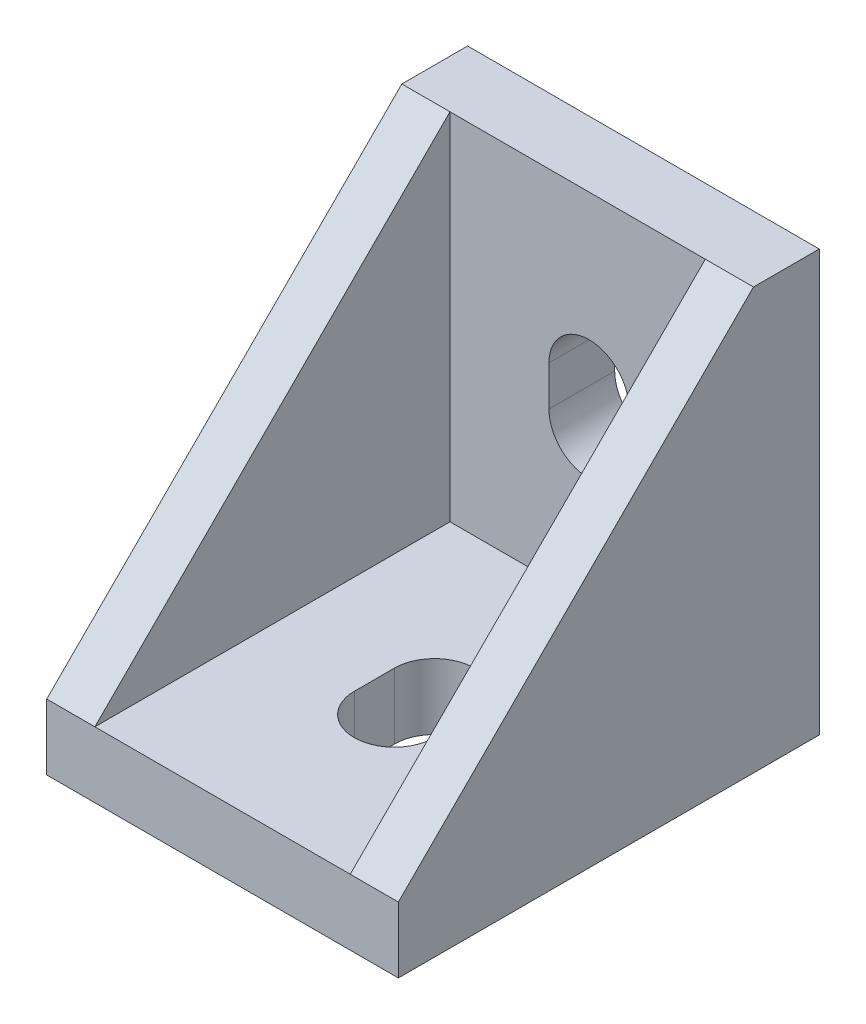
from build123d import *

# Parameters (mm, degrees)
SKETCH1_W           = 16.7005
SKETCH1_H           = 19.9898
BOSS_EXTRUDE1_DEPTH = 3.1242
SKETCH3_W           = 16.7005
SKETCH3_H           = 3.1242
BOSS_EXTRUDE2_DEPTH = 19.9898
BOSS_EXTRUDE3_DEPTH = 2.286
BOSS_EXTRUDE4_DEPTH = 2.286
CUT_EXTRUDE1_REACH  = 29.455
SKETCH6_R           = 1.905
CUT_EXTRUDE2_START  = -3.1242
CUT_EXTRUDE2_DEPTH  = 3.1242


# Read off the part's stored shape, not the designer's step: Cut-Extrude2
with BuildPart() as part:
    # Sketch1 → Boss-Extrude1 (new body)
    with BuildSketch(Plane(origin=(0, 0, 0), x_dir=(1, 0, 0), z_dir=(0, 1, 0))):
        Rectangle(SKETCH1_W, SKETCH1_H)
    extrude(amount=BOSS_EXTRUDE1_DEPTH)

    # Sketch3 → Boss-Extrude2 (add)
    with BuildSketch(Plane.XZ):
        with Locations((0, -8.4328)):
            Rectangle(SKETCH3_W, SKETCH3_H)
    extrude(amount=-BOSS_EXTRUDE2_DEPTH)

    # Sketch4 → Boss-Extrude3 (add)
    with BuildSketch(Plane(origin=(8.35025, 0, 0), x_dir=(0, 0, -1), z_dir=(1, 0, 0))):
        Polygon((6.8707, 19.9898), (-9.9949, 3.1242), (6.8707, 3.1242), align=None)
    extrude(amount=-BOSS_EXTRUDE3_DEPTH)

    # Sketch5 → Boss-Extrude4 (add)
    with BuildSketch(Plane.ZY.offset(8.35025)):
        Polygon((-6.8707, 19.9898), (9.9949, 3.1242), (-6.8707, 3.1242), align=None)
    extrude(amount=-BOSS_EXTRUDE4_DEPTH)

    # Sketch6 → Cut-Extrude1 (cut, up to next)
    with BuildSketch(Plane.XY.offset(-6.8707), mode=Mode.PRIVATE) as cut_extrude1_sk1:
        with Locations((0.53975, 10.1092)):
            Circle(SKETCH6_R)
    cut_extrude1_tool1 = extrude(cut_extrude1_sk1.sketch, amount=-CUT_EXTRUDE1_REACH, mode=Mode.PRIVATE) & part.part
    # Sketch6 → Cut-Extrude1 (cut, up to next)
    with BuildSketch(Plane.XY.offset(-6.8707), mode=Mode.PRIVATE) as cut_extrude1_sk2:
        with Locations((0.53975, 12.0142)):
            Circle(SKETCH6_R)
    cut_extrude1_tool2 = extrude(cut_extrude1_sk2.sketch, amount=-CUT_EXTRUDE1_REACH, mode=Mode.PRIVATE) & part.part
    # Sketch6 → Cut-Extrude1 (cut, up to next)
    with BuildSketch(Plane.XY.offset(-6.8707), mode=Mode.PRIVATE) as cut_extrude1_sk3:
        with BuildLine():
            Line((2.44475, 10.1092), (2.44475, 12.0142))
            ThreePointArc((2.44475, 12.0142), (2.379838699, 11.521149719), (2.189528394, 11.0617))
            ThreePointArc((2.189528394, 11.0617), (2.379838699, 10.602250281), (2.44475, 10.1092))
        make_face()
    cut_extrude1_tool3 = extrude(cut_extrude1_sk3.sketch, amount=-CUT_EXTRUDE1_REACH, mode=Mode.PRIVATE) & part.part
    # Sketch6 → Cut-Extrude1 (cut, up to next)
    with BuildSketch(Plane.XY.offset(-6.8707), mode=Mode.PRIVATE) as cut_extrude1_sk4:
        with Locations((0.53975, 12.0142)):
            Circle(SKETCH6_R)
    cut_extrude1_tool4 = extrude(cut_extrude1_sk4.sketch, amount=-CUT_EXTRUDE1_REACH, mode=Mode.PRIVATE) & part.part
    # Sketch6 → Cut-Extrude1 (cut, up to next)
    with BuildSketch(Plane.XY.offset(-6.8707), mode=Mode.PRIVATE) as cut_extrude1_sk5:
        with Locations((0.53975, 10.1092)):
            Circle(SKETCH6_R)
    cut_extrude1_tool5 = extrude(cut_extrude1_sk5.sketch, amount=-CUT_EXTRUDE1_REACH, mode=Mode.PRIVATE) & part.part
    # Sketch6 → Cut-Extrude1 (cut, up to next)
    with BuildSketch(Plane.XY.offset(-6.8707), mode=Mode.PRIVATE) as cut_extrude1_sk6:
        with BuildLine():
            ThreePointArc((-1.110028394, 11.0617), (-1.300338699, 11.521149719), (-1.36525, 12.0142))
            Line((-1.36525, 12.0142), (-1.36525, 10.1092))
            ThreePointArc((-1.36525, 10.1092), (-1.300338699, 10.602250281), (-1.110028394, 11.0617))
        make_face()
    cut_extrude1_tool6 = extrude(cut_extrude1_sk6.sketch, amount=-CUT_EXTRUDE1_REACH, mode=Mode.PRIVATE) & part.part
    # Sketch6 → Cut-Extrude1 (cut, up to next)
    with BuildSketch(Plane.XY.offset(-6.8707), mode=Mode.PRIVATE) as cut_extrude1_sk7:
        with Locations((0.53975, 10.1092)):
            Circle(SKETCH6_R)
    cut_extrude1_tool7 = extrude(cut_extrude1_sk7.sketch, amount=-CUT_EXTRUDE1_REACH, mode=Mode.PRIVATE) & part.part
    # Sketch6 → Cut-Extrude1 (cut, up to next)
    with BuildSketch(Plane.XY.offset(-6.8707), mode=Mode.PRIVATE) as cut_extrude1_sk8:
        with Locations((0.53975, 12.0142)):
            Circle(SKETCH6_R)
    cut_extrude1_tool8 = extrude(cut_extrude1_sk8.sketch, amount=-CUT_EXTRUDE1_REACH, mode=Mode.PRIVATE) & part.part
    add(cut_extrude1_tool1.solids().sort_by_distance((0.53975, 10.1092, -6.8707))[0], mode=Mode.SUBTRACT)
    add(cut_extrude1_tool2.solids().sort_by_distance((0.53975, 12.0142, -6.8707))[0], mode=Mode.SUBTRACT)
    add(cut_extrude1_tool3.solids().sort_by_distance((2.369151, 11.0617, -6.8707))[0], mode=Mode.SUBTRACT)
    add(cut_extrude1_tool4.solids().sort_by_distance((0.53975, 12.0142, -6.8707))[0], mode=Mode.SUBTRACT)
    add(cut_extrude1_tool5.solids().sort_by_distance((0.53975, 10.1092, -6.8707))[0], mode=Mode.SUBTRACT)
    add(cut_extrude1_tool6.solids().sort_by_distance((-1.289651, 11.0617, -6.8707))[0], mode=Mode.SUBTRACT)
    add(cut_extrude1_tool7.solids().sort_by_distance((0.53975, 10.1092, -6.8707))[0], mode=Mode.SUBTRACT)
    add(cut_extrude1_tool8.solids().sort_by_distance((0.53975, 12.0142, -6.8707))[0], mode=Mode.SUBTRACT)

    # Cut-Extrude2 outline → Cut-Extrude2 (cut)
    with BuildSketch(Plane(origin=(0, 3.1242, 0), x_dir=(1, 0, 0), z_dir=(0, 1, 0)).offset(CUT_EXTRUDE2_START)):
        with BuildLine():
            Line((-1.36525, -0.4699), (-1.36525, -2.3749))
            ThreePointArc((-1.36525, -2.3749), (0.53975, -4.2799), (2.44475, -2.3749))
            Line((2.44475, -2.3749), (2.437778565, -0.307073202))
            ThreePointArc((2.437778565, -0.307073202), (0.458262015, 1.433356343), (-1.36525, -0.4699))
        make_face()
    extrude(amount=CUT_EXTRUDE2_DEPTH, mode=Mode.SUBTRACT)


solid = part.part
